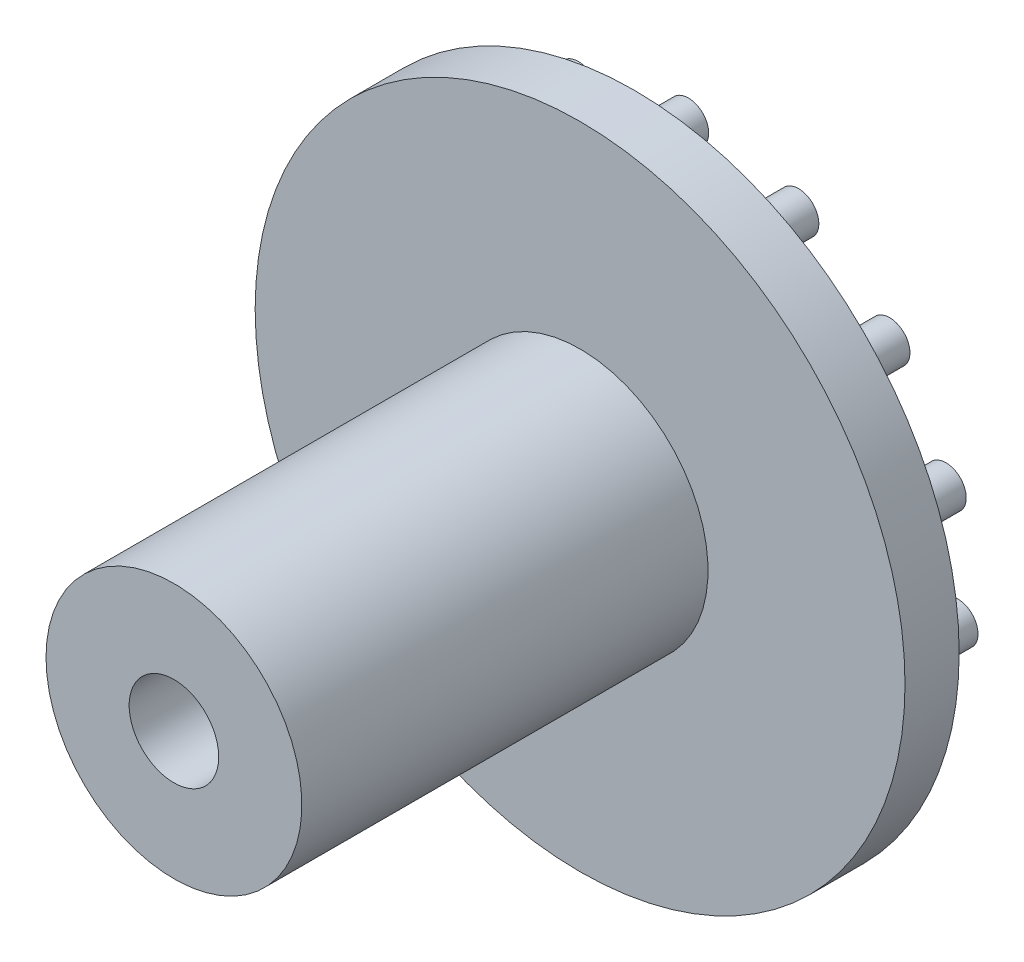
from build123d import *

# Parameters (mm, degrees)
SKETCH1_R             = 15.24
SKETCH1_R_2           = 4.55
BOSS_EXTRUDE1_DEPTH   = 2.54
SKETCH2_R             = 6
BOSS_EXTRUDE2_DEPTH   = 19.05
SKETCH5_R             = 0.9525
BOSS_EXTRUDE5_DEPTH   = 2.54
M5X0_8_TAPPED_HOLE2_D = 4.2


with BuildPart() as part:
    # Sketch1 → Boss-Extrude1 (new body)
    with BuildSketch(Plane.XY):
        Circle(SKETCH1_R)
        Circle(SKETCH1_R_2, mode=Mode.SUBTRACT)
    extrude(amount=BOSS_EXTRUDE1_DEPTH)

    # Sketch2 → Boss-Extrude2 (add)
    with BuildSketch(Plane.XY.offset(2.54)):
        Circle(SKETCH2_R)
    extrude(amount=BOSS_EXTRUDE2_DEPTH)

    # Sketch5 → Boss-Extrude5 (add)
    with BuildSketch(Plane(origin=(0, 0, 0), x_dir=(-1, 0, 0), z_dir=(0, 0, -1))):
        with Locations((0, 12.7)):
            Circle(SKETCH5_R)
        with Locations((5.165555367, 11.602027312)):
            Circle(SKETCH5_R)
        with Locations((9.437939284, 8.497958701)):
            Circle(SKETCH5_R)
        with Locations((12.078417757, 3.924515829)):
            Circle(SKETCH5_R)
        with Locations((12.630428071, -1.327511483)):
            Circle(SKETCH5_R)
        with Locations((10.998522628, -6.35)):
            Circle(SKETCH5_R)
        with Locations((7.464872704, -10.274515829)):
            Circle(SKETCH5_R)
        with Locations((2.640478473, -12.422474529)):
            Circle(SKETCH5_R)
        with Locations((-2.640478473, -12.422474529)):
            Circle(SKETCH5_R)
        with Locations((-7.464872704, -10.274515829)):
            Circle(SKETCH5_R)
        with Locations((-10.998522628, -6.35)):
            Circle(SKETCH5_R)
        with Locations((-12.630428071, -1.327511483)):
            Circle(SKETCH5_R)
        with Locations((-12.078417757, 3.924515829)):
            Circle(SKETCH5_R)
        with Locations((-9.437939284, 8.497958701)):
            Circle(SKETCH5_R)
        with Locations((-5.165555367, 11.602027312)):
            Circle(SKETCH5_R)
    extrude(amount=BOSS_EXTRUDE5_DEPTH)

    # M5x0.8 Tapped Hole2 (through all)
    with Locations(Plane.XY.offset(21.59)):
        with Locations((0, 0)):
            Hole(M5X0_8_TAPPED_HOLE2_D / 2)


solid = part.part
